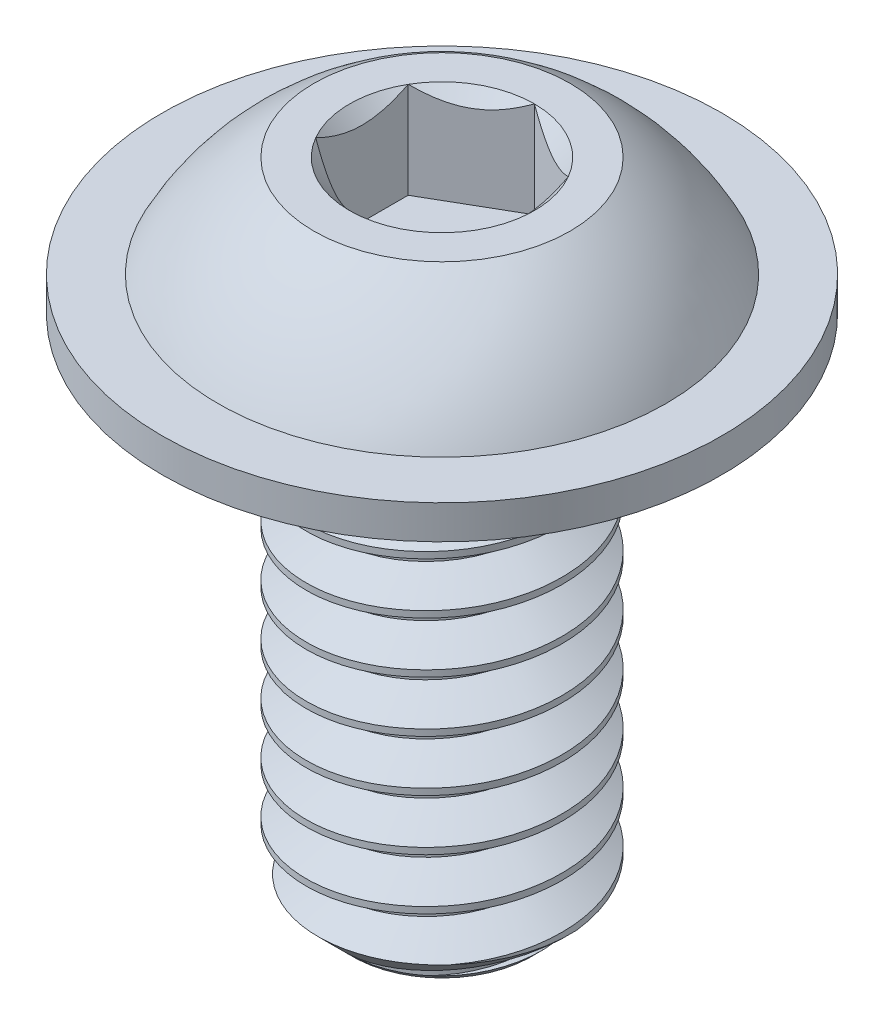
from build123d import *

# Parameters (mm, degrees)
SKETCH1_R           = 3.175
BOSS_EXTRUDE1_DEPTH = 12.7
CUT_SWEEP1_PITCH    = 1.27
SKETCH4_OUTSIDE_W   = 14
SKETCH4_OUTSIDE_H   = 14
SKETCH4_OUTSIDE_R   = 2.21262927
CUT_EXTRUDE1_DEPTH  = 1.27
CUT_EXTRUDE1_DRAFT  = -45
CUT_EXTRUDE2_DEPTH  = 2.38125
BOSS_EXTRUDE2_START = -6.35
SKETCH8_R           = 3.175
BOSS_EXTRUDE2_DEPTH = 2.3876
SKETCH9_R           = 3.5687
SKETCH9_R_2         = 3.175
BOSS_EXTRUDE3_DEPTH = 0.762


with BuildPart() as part:
    # Sketch1 → Boss-Extrude1 (new body)
    with BuildSketch(Plane(origin=(0, 0, 0), x_dir=(1, 0, 0), z_dir=(0, 1, 0))):
        with Locations(Location((-12.7, 0, 0), (0, 0, 270))):
            Circle(SKETCH1_R)
    extrude(amount=-BOSS_EXTRUDE1_DEPTH)

    # Cut-Sweep1: the profile of Sketch3 screwed along a right-hand helix of 11 turns, 8 arcs to a turn; built about Z, then put on its axis
    cut_sweep1_z = Axis((0, 0, 0), (0, 0, 1))
    cut_sweep1_corners = [(2.350110803, 0, -0.47625), (3.243740766, 0, 0.0396875), (3.243740766, 0, -1.1509375), (2.350110803, 0, -0.635)]
    with BuildLine(mode=Mode.PRIVATE) as cut_sweep1_profile:
        Line(cut_sweep1_corners[0], cut_sweep1_corners[1])
        Line(cut_sweep1_corners[1], cut_sweep1_corners[2])
        Line(cut_sweep1_corners[2], cut_sweep1_corners[3])
        Line(cut_sweep1_corners[3], cut_sweep1_corners[0])
    cut_sweep1_cap = Face(cut_sweep1_profile.wire())
    cut_sweep1_turn_angles = [0, 22.5, 45, 67.5, 90, 112.5, 135, 157.5, 180, 202.5, 225, 247.5, 270, 292.5, 315, 337.5, 360]
    cut_sweep1_turn_weights = [1, 0.9238795325112867, 1, 0.9238795325112867, 1, 0.9238795325112867, 1, 0.9238795325112867, 1, 0.9238795325112867, 1, 0.9238795325112867, 1, 0.9238795325112867, 1, 0.9238795325112867, 1]
    cut_sweep1_turn_rails = [Edge.make_bspline([Vector(p[0], p[1], 0).rotate(cut_sweep1_z, cut_sweep1_turn_angles[k]) / cut_sweep1_turn_weights[k] + Vector(0, 0, p[2] + CUT_SWEEP1_PITCH * cut_sweep1_turn_angles[k] / 360) for k in range(17)], [0, 0, 0, 1, 1, 2, 2, 3, 3, 4, 4, 5, 5, 6, 6, 7, 7, 8, 8, 8], 2, cut_sweep1_turn_weights) for p in cut_sweep1_corners]
    cut_sweep1_turn_sides = [Face.make_surface_from_curves(cut_sweep1_turn_rails[p[0]], cut_sweep1_turn_rails[p[1]]) for p in [(0, 1), (1, 2), (2, 3), (3, 0)]]
    cut_sweep1 = Plane(origin=(-12.7, -12.7, 0), x_dir=(0, 0, -1), z_dir=(0, 1, 0)) * Solid(Shell([*[p.moved(Location((0, 0, CUT_SWEEP1_PITCH * i))) for i in range(11) for p in cut_sweep1_turn_sides], cut_sweep1_cap, cut_sweep1_cap.rotate(cut_sweep1_z, 3960).moved(Location((0, 0, CUT_SWEEP1_PITCH * 3960 / 360)))]))
    add(cut_sweep1, mode=Mode.SUBTRACT)


with BuildPart() as cut_extrude1_tool:
    # Sketch4 outside → Cut-Extrude1 (with draft: the straight prism first)
    with BuildSketch(Plane.XZ.offset(12.7)):
        with Locations((-12.7, 0)):
            Rectangle(SKETCH4_OUTSIDE_W, SKETCH4_OUTSIDE_H)
        with Locations((-12.7, 0)):
            Circle(SKETCH4_OUTSIDE_R, mode=Mode.SUBTRACT)
    extrude(amount=-CUT_EXTRUDE1_DEPTH)
    # Cut-Extrude1: the draft: its side faces are tilted about the plane it starts from
    cut_extrude1_sides = [cut_extrude1_tool.faces().sort_by_distance(p)[0] for p in [
        (-12.7, -12.065, -7),
        (-5.7, -12.065, 0),
        (-12.7, -12.065, 7),
        (-19.7, -12.065, 0),
        (-14.91262927, -12.065, 0),
    ]]
    draft(cut_extrude1_sides, Plane.XZ.offset(12.7), CUT_EXTRUDE1_DRAFT)


with BuildPart() as part_1:
    add(part.part)

    # Cut-Extrude1: cut by cut_extrude1_tool
    add(cut_extrude1_tool.part, mode=Mode.SUBTRACT)

    # Sketch5 → Revolve1 (revolve)
    with BuildSketch(Plane.XY, mode=Mode.PRIVATE) as revolve1_sk:
        with BuildLine():
            Line((-12.7, 0), (-12.7, 3.3528))
            Line((-12.7, 3.3528), (-15.875, 3.3528))
            ThreePointArc((-15.875, 3.3528), (-17.240019085, 2.263204136), (-18.2499, 0.8382))
            Line((-18.2499, 0.8382), (-19.6342, 0.8382))
            Line((-19.6342, 0.8382), (-19.6342, 0))
            Line((-19.6342, 0), (-12.7, 0))
        make_face()
    revolve(revolve1_sk.sketch.rotate(Axis((-12.7, 0, 0), (0, 1, 0)), 270), axis=Axis((-12.7, 0, 0), (0, 1, 0)))

    # Sketch6 → Cut-Extrude2 (cut)
    with BuildSketch(Plane(origin=(0, 3.3528, 0), x_dir=(1, 0, 0), z_dir=(0, 1, 0))):
        Polygon((-12.7, 2.291358881), (-14.684375, 1.14567944), (-14.684375, -1.14567944), (-12.7, -2.291358881), (-10.715625, -1.14567944), (-10.715625, 1.14567944), align=None)
    extrude(amount=-CUT_EXTRUDE2_DEPTH, mode=Mode.SUBTRACT)

    # Cut-Extrude3 cone 1 section (through the dimple's axis) → Cut-Extrude3 (revolve, cut)
    with BuildSketch(Plane(origin=(-12.7, 3.3528, 0), x_dir=(0, 0, 1), z_dir=(1, 0, 0))):
        Polygon((0, 0), (2.291358881, 0), (0, 2.291358881), align=None)
    revolve(axis=Axis((-12.7, 3.3528, 0), (0, -1, 0)), mode=Mode.SUBTRACT)


with BuildPart() as body_2:
    # Body-Move/Copy1: copy of part
    add(part_1.part.moved(Location((25.4, 0, 0))))


with BuildPart() as body_3:
    # Sketch8 → Boss-Extrude2 (new body)
    with BuildSketch(Plane(origin=(0, 0, 0), x_dir=(1, 0, 0), z_dir=(0, 1, 0)).offset(BOSS_EXTRUDE2_START)):
        with BuildLine():
            Line((-21.474187891, 5.6261), (21.474187891, 5.6261))
            ThreePointArc((21.474187891, 5.6261), (23.8125, 0), (21.474187891, -5.6261))
            Line((21.474187891, -5.6261), (-21.474187891, -5.6261))
            ThreePointArc((-21.474187891, -5.6261), (-23.8125, 0), (-21.474187891, 5.6261))
        make_face()
        with Locations(Location((-12.7, 0, 0), (0, 0, 270))):
            Circle(SKETCH8_R, mode=Mode.SUBTRACT)
        with Locations(Location((12.7, 0, 0), (0, 0, 270))):
            Circle(SKETCH8_R, mode=Mode.SUBTRACT)
    extrude(amount=-BOSS_EXTRUDE2_DEPTH)

    # Sketch9 → Boss-Extrude3 (add)
    # profile 1 of 2: a face of its own
    with BuildSketch(Plane.XZ.offset(8.7376)):
        with Locations(Location((-12.7, 0, 0), (0, 0, 90))):
            Circle(SKETCH9_R)
        with Locations(Location((-12.7, 0, 0), (0, 0, 90))):
            Circle(SKETCH9_R_2, mode=Mode.SUBTRACT)
    # profile 2 of 2: a face of its own
    with BuildSketch(Plane.XZ.offset(8.7376)):
        with Locations(Location((12.7, 0, 0), (0, 0, 90))):
            Circle(SKETCH9_R)
        with Locations(Location((12.7, 0, 0), (0, 0, 90))):
            Circle(SKETCH9_R_2, mode=Mode.SUBTRACT)
    extrude(amount=BOSS_EXTRUDE3_DEPTH)


solid = part_1.part
